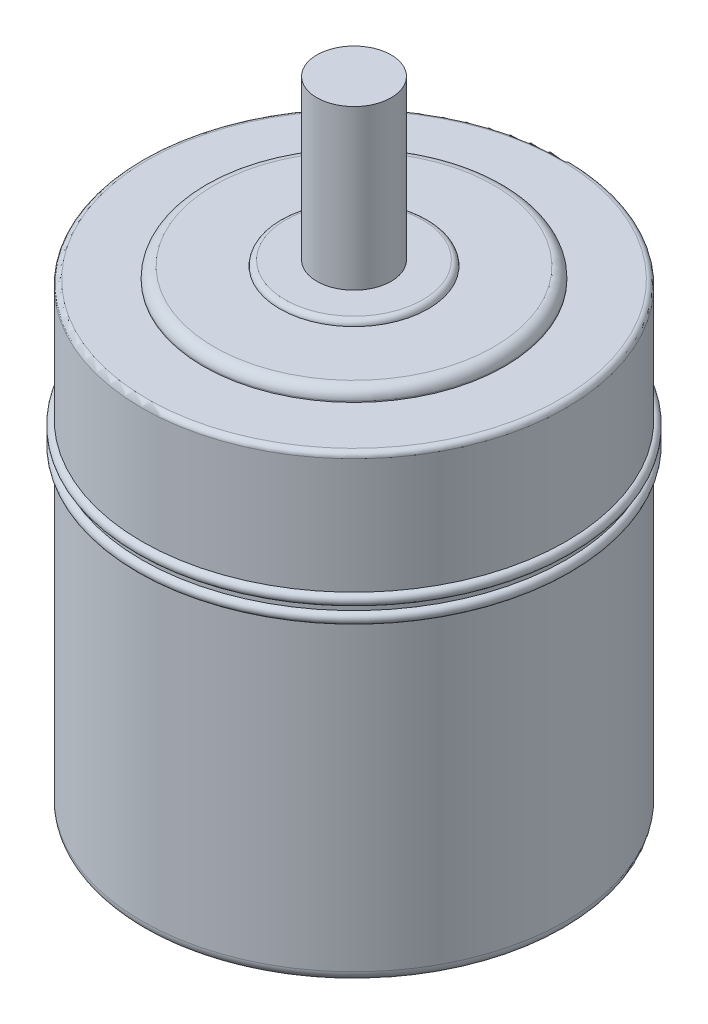
from build123d import *

# Parameters (mm, degrees)
SKETCH2_R = 0.635
FILLET1_R = 0.635
FILLET2_R = 1.27
FILLET3_R = 0.635


with BuildPart() as part:
    # Sketch1 → Revolve1 (revolve)
    with BuildSketch(Plane.XY):
        Polygon((0, 0), (0, 76.2), (4.445, 76.2), (4.445, 57.15), (8.89, 57.15), (8.89, 56.515), (18.034, 56.515), (18.034, 55.118), (25.4, 55.118), (25.4, 0), align=None)
    revolve(axis=Axis((0, 0, 0), (0, 1, 0)))

    # Sketch2 → Revolve2 (revolve)
    with BuildSketch(Plane.XY, mode=Mode.PRIVATE) as revolve2_sk:
        with Locations((25.4, 40.005)):
            Circle(SKETCH2_R)
        with Locations((25.4, 38.1)):
            Circle(SKETCH2_R)
    revolve(revolve2_sk.sketch.rotate(Axis((0, 0, 0), (0, 1, 0)), 90), axis=Axis((0, 0, 0), (0, 1, 0)))

    # Fillet1
    fillet1_edges = [part.edges().sort_by_distance(p)[0] for p in [
        (-8.89, 57.15, 0),
    ]]
    fillet(fillet1_edges, radius=FILLET1_R - 0.0001)  # a hair under: the kernel refuses the full size

    # Fillet2
    fillet2_edges = [part.edges().sort_by_distance(p)[0] for p in [
        (-25.4, 0, 0),
        (-18.034, 56.515, 0),
    ]]
    fillet(fillet2_edges, radius=FILLET2_R)

    # Fillet3
    fillet3_edges = [part.edges().sort_by_distance(p)[0] for p in [
        (-25.4, 55.118, 0),
    ]]
    fillet(fillet3_edges, radius=FILLET3_R)


solid = part.part
